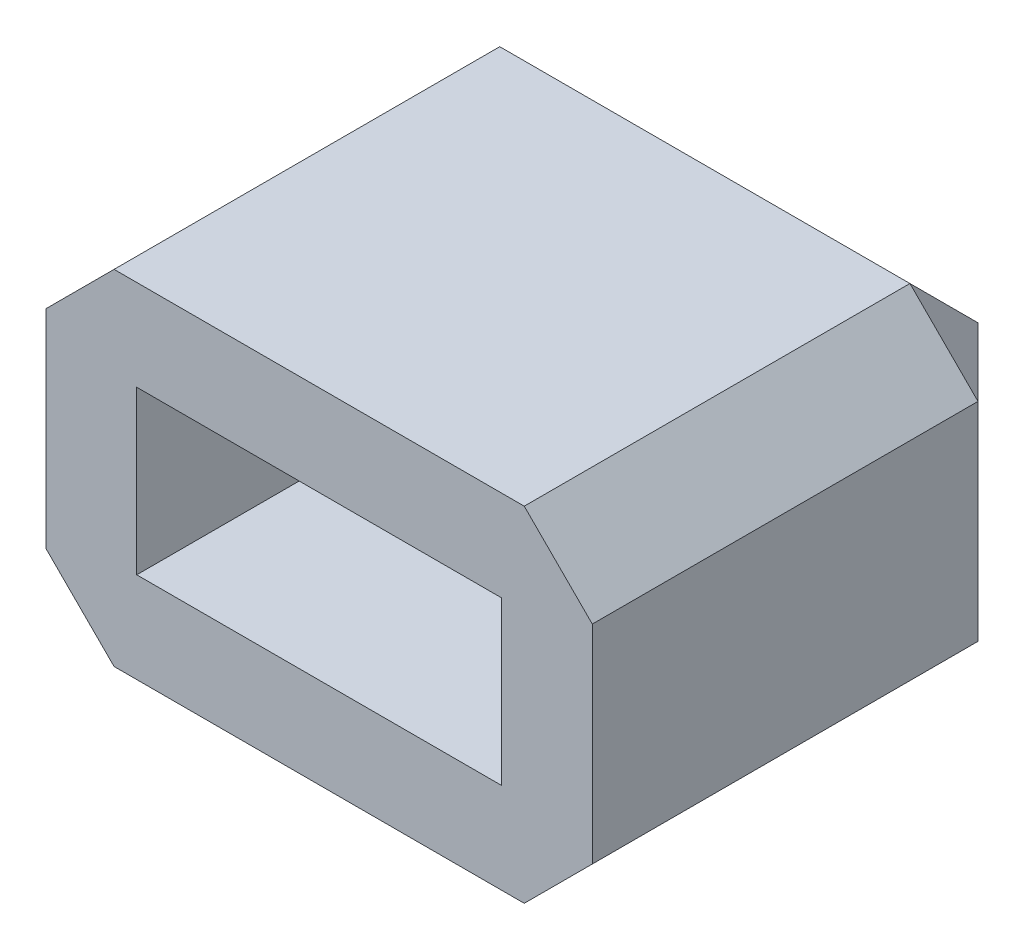
from build123d import *

# Parameters (mm, degrees)
SKETCH1_W           = 12.04
SKETCH1_H           = 7.58
SKETCH1_W_2         = 8.04
SKETCH1_H_2         = 3.58
BOSS_EXTRUDE1_DEPTH = 8
SKETCH1_2_W         = 12.04
SKETCH1_2_H         = 7.58
BOSS_EXTRUDE2_DEPTH = 2
CHAMFER1_SIZE       = 1.5


with BuildPart() as part:
    # Sketch1 → Boss-Extrude1 (new body)
    with BuildSketch(Plane.XY):
        Rectangle(SKETCH1_W, SKETCH1_H)
        Rectangle(SKETCH1_W_2, SKETCH1_H_2, mode=Mode.SUBTRACT)
    extrude(amount=BOSS_EXTRUDE1_DEPTH)

    # Sketch1<2> → Boss-Extrude2 (add)
    with BuildSketch(Plane.XY):
        Rectangle(SKETCH1_2_W, SKETCH1_2_H)
    extrude(amount=-BOSS_EXTRUDE2_DEPTH)

    # Chamfer1
    chamfer1_edges = [part.edges().sort_by_distance(p)[0] for p in [
        (-6.02, -3.79, 3),
        (0, -3.79, -2),
        (-6.02, 0, -2),
        (-6.02, 3.79, 3),
        (0, 3.79, -2),
        (6.02, 3.79, 3),
        (6.02, -3.79, 3),
        (6.02, 0, -2),
    ]]
    chamfer(chamfer1_edges, length=CHAMFER1_SIZE)


solid = part.part
